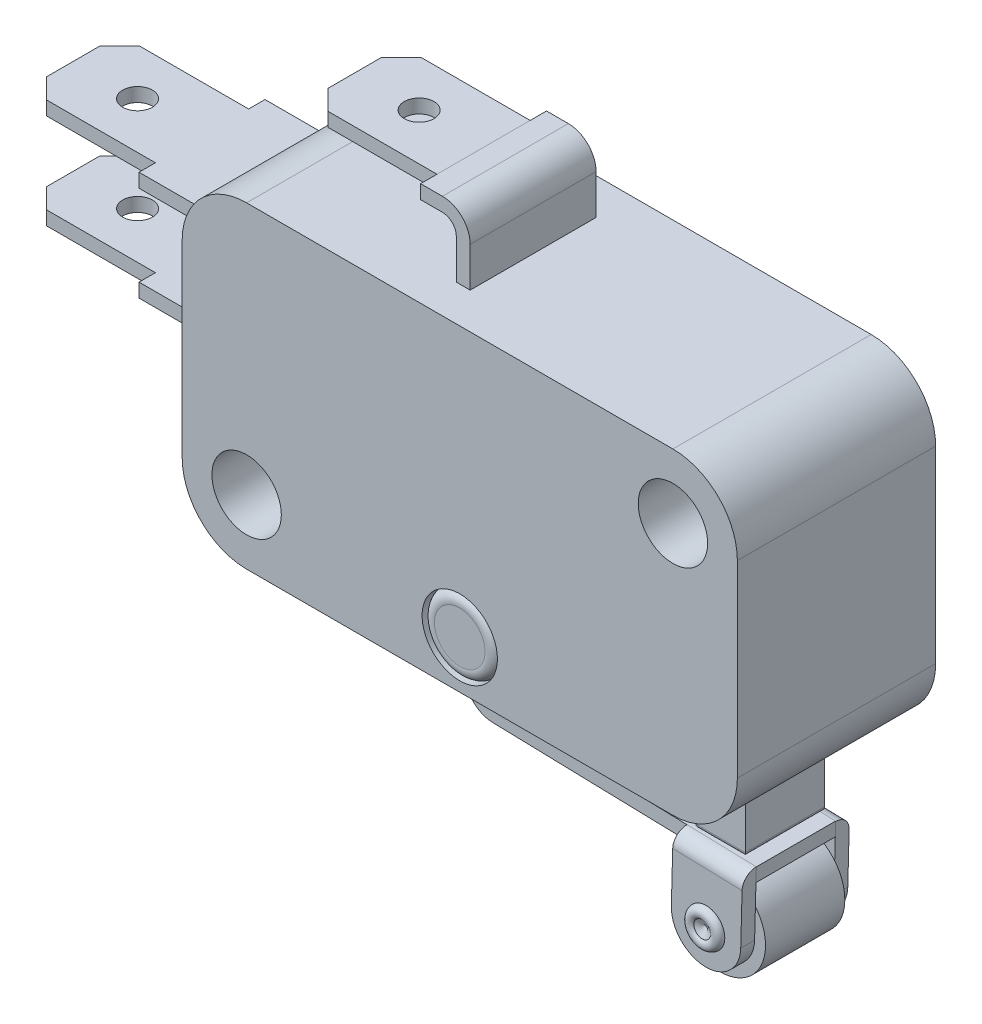
from build123d import *

# Parameters (mm, degrees)
ESQUISSE1_R                = 1.75
ESQUISSE1_R_2              = 1.9
BOSS_EXTRU_1_DEPTH         = 10
ENL_V_MAT_EXTRU_1_DEPTH    = 3
BOSS_EXTRU_6_DEPTH         = 4
CONG_1_R                   = 0.2
BOSS_EXTRU_7_DEPTH         = 4
ESQUISSE11_W               = 0.7
ESQUISSE11_H               = 5
BOSS_EXTRU_8_DEPTH         = 3.5
BOSS_EXTRU_8_2_DEPTH       = 3.5
CONG_2_R                   = 1.75
CONG_3_R                   = 1.75
CONG_4_R                   = 0.7
CONG_5_R                   = 0.7
ESQUISSE12_R               = 0.75
ENL_V_MAT_EXTRU_2_DEPTH    = 23.696495837
ESQUISSE13_R               = 2.3
BOSS_EXTRU_9_DEPTH         = 4
ESQUISSE3_R                = 1.9
BOSS_EXTRU_2_DEPTH         = 3
ESQUISSE6_R                = 0.75
BOSS_EXTRU_3_DEPTH         = 0.7
R_P_TITION_LIN_AIRE1_COUNT = 2
R_P_TITION_LIN_AIRE1_PITCH = 4.8
BOSS_EXTRU_4_DEPTH         = 6.35
ESQUISSE8_R                = 0.75
BOSS_EXTRU_5_DEPTH         = 0.7


with BuildPart() as part:
    # Esquisse1 → Boss.-Extru.1 (new body)
    with BuildSketch(Plane.XY):
        with BuildLine():
            Line((10.75, -8), (-10.75, -8))
            ThreePointArc((-10.75, -8), (-13.048097039, -7.048097039), (-14, -4.75))
            Line((-14, -4.75), (-14, 4.75))
            ThreePointArc((-14, 4.75), (-13.048097039, 7.048097039), (-10.75, 8))
            Line((-10.75, 8), (10.75, 8))
            ThreePointArc((10.75, 8), (13.048097039, 7.048097039), (14, 4.75))
            Line((14, 4.75), (14, -4.75))
            ThreePointArc((14, -4.75), (13.048097039, -7.048097039), (10.75, -8))
        make_face()
        with Locations((10.75, 4.75)):
            Circle(ESQUISSE1_R, mode=Mode.SUBTRACT)
        with Locations((-10.75, -4.75)):
            Circle(ESQUISSE1_R, mode=Mode.SUBTRACT)
        with Locations((0, -5.6)):
            Circle(ESQUISSE1_R_2, mode=Mode.SUBTRACT)
    extrude(amount=-BOSS_EXTRU_1_DEPTH)

    # Esquisse2 → Enlèv. mat.-Extru.1 (cut)
    with BuildSketch(Plane.XY):
        with BuildLine():
            Line((-10.75, 8), (8.5, 8))
            Line((8.5, 8), (8.5, 4.75))
            ThreePointArc((8.5, 4.75), (9.159009742, 3.159009742), (10.75, 2.5))
            Line((10.75, 2.5), (14, 2.5))
            Line((14, 2.5), (14, -4.75))
            ThreePointArc((14, -4.75), (13.048097039, -7.048097039), (10.75, -8))
            Line((10.75, -8), (-8.5, -8))
            Line((-8.5, -8), (-8.5, -4.75))
            ThreePointArc((-8.5, -4.75), (-9.159009742, -3.159009742), (-10.75, -2.5))
            Line((-10.75, -2.5), (-14, -2.5))
            Line((-14, -2.5), (-14, 4.75))
            ThreePointArc((-14, 4.75), (-13.048097039, 7.048097039), (-10.75, 8))
        make_face()
    extrude(amount=-ENL_V_MAT_EXTRU_1_DEPTH, mode=Mode.SUBTRACT)



with BuildPart() as body_2:
    # Esquisse9 → Boss.-Extru.6 (new body)
    with BuildSketch(Plane.XY.offset(-3)):
        Polygon((8.9, -8), (8.9, -11), (11.4, -11), (11.4, -8), (11.4, -7), (8.9, -7), align=None)
    extrude(amount=-BOSS_EXTRU_6_DEPTH)

    # Congé1
    cong_1_edges = [body_2.edges().sort_by_distance(p)[0] for p in [
        (10.15, -11, -7),
        (11.4, -11, -5),
        (8.9, -11, -5),
        (10.15, -11, -3),
    ]]
    fillet(cong_1_edges, radius=CONG_1_R)


with BuildPart() as part_1:
    add(part.part)

    add(body_2.part)  # Boss.-Extru.7 merges body 2
    # Esquisse10 → Boss.-Extru.7 (add)
    with BuildSketch(Plane.XY.offset(-3)):
        with BuildLine():
            Line((-1.899320944, -5.549206791), (-2.020293411, -10.072755239))
            ThreePointArc((-2.020293411, -10.072755239), (-1.828573726, -10.573034078), (-1.339256877, -10.791218348))
            Line((-1.339256877, -10.791218348), (11.955989734, -11.146770808))
            Line((11.955989734, -11.146770808), (11.937276447, -11.846520629))
            Line((11.937276447, -11.846520629), (-1.357970164, -11.490968169))
            ThreePointArc((-1.357970164, -11.490968169), (-2.336603862, -11.054599629), (-2.720043233, -10.054041951))
            Line((-2.720043233, -10.054041951), (-2.599070766, -5.530493504))
            Line((-2.599070766, -5.530493504), (-1.899320944, -5.549206791))
        make_face()
    extrude(amount=-BOSS_EXTRU_7_DEPTH)


with BuildPart() as body_2_2:
    # Esquisse11 → Boss.-Extru.8 (new body)
    with BuildSketch(Plane(origin=(12.245328283, -0.327474678, 0), x_dir=(0, 0, -1), z_dir=(0.9996426023327817, -0.026733267689230993, 0))):
        with Locations((2.65, -13.323164304)):
            Rectangle(ESQUISSE11_W, ESQUISSE11_H)
    extrude(amount=-BOSS_EXTRU_8_DEPTH)

    # Congé2
    cong_2_edges = [body_2_2.edges().sort_by_distance(p)[0] for p in [
        (8.323574287, -16.051417383, -2.65),
        (11.822323396, -16.14498382, -2.65),
    ]]
    fillet(cong_2_edges, radius=CONG_2_R - 0.0001)  # a hair under: the kernel refuses the full size

    # Congé4
    cong_4_edges = [body_2_2.edges().sort_by_distance(p)[0] for p in [
        (10.20661518, -11.099987589, -2.3),
    ]]
    fillet(cong_4_edges, radius=CONG_4_R - 0.0001)  # a hair under: the kernel refuses the full size


with BuildPart() as body_3:
    # Esquisse11 → Boss.-Extru.8 2 (new body)
    with BuildSketch(Plane(origin=(12.245328283, -0.327474678, 0), x_dir=(0, 0, -1), z_dir=(0.9996426023327817, -0.026733267689230993, 0))):
        with Locations((7.35, -13.343925022)):
            Rectangle(ESQUISSE11_W, ESQUISSE11_H)
    extrude(amount=-BOSS_EXTRU_8_2_DEPTH)

    # Congé3
    cong_3_edges = [body_3.edges().sort_by_distance(p)[0] for p in [
        (11.821768394, -16.165737117, -7.35),
        (8.323019286, -16.07217068, -7.35),
    ]]
    fillet(cong_3_edges, radius=CONG_3_R - 0.0001)  # a hair under: the kernel refuses the full size

    # Congé5
    cong_5_edges = [body_3.edges().sort_by_distance(p)[0] for p in [
        (10.206060178, -11.120740887, -7.7),
    ]]
    fillet(cong_5_edges, radius=CONG_5_R - 0.0001)  # a hair under: the kernel refuses the full size


with BuildPart() as enl_v_mat_extru_2_tool:
    # Esquisse12 → Enlèv. mat.-Extru.2 (new, through all)
    with BuildSketch(Plane.XY.offset(-2.3)):
        with Locations((10.11973206, -14.348826047)):
            Circle(ESQUISSE12_R)
    extrude(amount=-ENL_V_MAT_EXTRU_2_DEPTH)


with BuildPart() as body_2_2_1:
    add(body_2_2.part)

    # Enlèv. mat.-Extru.2: cut by enl_v_mat_extru_2_tool
    add(enl_v_mat_extru_2_tool.part, mode=Mode.SUBTRACT)


with BuildPart() as body_3_1:
    add(body_3.part)

    # Enlèv. mat.-Extru.2: cut by enl_v_mat_extru_2_tool
    add(enl_v_mat_extru_2_tool.part, mode=Mode.SUBTRACT)


with BuildPart() as body_4:
    # Esquisse13 → Boss.-Extru.9 (new body)
    with BuildSketch(Plane.XY.offset(-7)):
        with Locations((10.11973206, -14.348826047)):
            Circle(ESQUISSE13_R)
    extrude(amount=BOSS_EXTRU_9_DEPTH)


with BuildPart() as body_5:
    # Esquisse14 → Révolution3 (revolve)
    with BuildSketch(Plane(origin=(10.495953729, -0.280691459, 0), x_dir=(0, 0, -1), z_dir=(0.9996426023327817, -0.026733267689230993, 0)), mode=Mode.PRIVATE) as r_volution3_sk:
        with BuildLine():
            Line((2.3, -13.323164304), (7.7, -13.323164304))
            Line((7.7, -13.323164304), (7.7, -13.123945463))
            ThreePointArc((7.7, -13.123945463), (7.984261411, -13.319118763), (7.904232859, -13.654517925))
            Line((7.904232859, -13.654517925), (7.7, -14.093925022))
            Line((7.7, -14.093925022), (2.3, -14.073164304))
            Line((2.3, -14.073164304), (2.109386747, -13.654517925))
            ThreePointArc((2.109386747, -13.654517925), (2.018113254, -13.322200994), (2.3, -13.123945463))
            Line((2.3, -13.123945463), (2.3, -13.323164304))
        make_face()
    revolve(r_volution3_sk.sketch.rotate(Axis((10.11973206, -14.348826047, -2.3), (-0.00010277735549151781, -0.003843174889761963, -0.9999926096944827)), 178.468125403), axis=Axis((10.11973206, -14.348826047, -2.3), (-0.00010277735549151781, -0.003843174889761963, -0.9999926096944827)))


with BuildPart() as body_6:
    # Esquisse3 → Boss.-Extru.2 (new body)
    with BuildSketch(Plane.XY.offset(-3)):
        with BuildLine():
            Line((-14, 4.75), (-14, -2.5))
            Line((-14, -2.5), (-10.75, -2.5))
            ThreePointArc((-10.75, -2.5), (-9.159009742, -3.159009742), (-8.5, -4.75))
            Line((-8.5, -4.75), (-8.5, -8))
            Line((-8.5, -8), (10.75, -8))
            ThreePointArc((10.75, -8), (13.048097039, -7.048097039), (14, -4.75))
            Line((14, -4.75), (14, 2.5))
            Line((14, 2.5), (10.75, 2.5))
            ThreePointArc((10.75, 2.5), (9.159009742, 3.159009742), (8.5, 4.75))
            Line((8.5, 4.75), (8.5, 8))
            Line((8.5, 8), (-10.75, 8))
            ThreePointArc((-10.75, 8), (-13.048097039, 7.048097039), (-14, 4.75))
        make_face()
        with Locations((0, -5.6)):
            Circle(ESQUISSE3_R, mode=Mode.SUBTRACT)
    extrude(amount=BOSS_EXTRU_2_DEPTH)


with BuildPart() as body_7:
    # Esquisse5 → Révolution1 (revolve)
    with BuildSketch(Plane(origin=(0, 0, 0), x_dir=(0, 0, -1), z_dir=(1, 0, 0)), mode=Mode.PRIVATE) as r_volution1_sk:
        with BuildLine():
            Line((0.5, -3.713984525), (9.5, -3.713984525))
            ThreePointArc((9.5, -3.713984525), (10.018007737, -4.231992263), (9.5, -4.75))
            Line((9.5, -4.75), (9.5, -5.6))
            Line((9.5, -5.6), (0, -5.6))
            Line((0, -5.6), (0, -4.32357469))
            ThreePointArc((0, -4.32357469), (0.105791879, -3.900496761), (0.5, -3.713984525))
        make_face()
    revolve(r_volution1_sk.sketch.rotate(Axis((0, -5.6, -5.056443534), (0, 0, -1)), 90), axis=Axis((0, -5.6, -5.056443534), (0, 0, -1)))


with BuildPart() as body_8:
    # Esquisse6 → Boss.-Extru.3 (new body)
    with BuildSketch(Plane(origin=(0, 0, 0), x_dir=(1, 0, 0), z_dir=(0, 1, 0))):
        Polygon((-14, 8.175), (-18, 8.175), (-18, 7.35), (-23.5, 7.35), (-24.5, 6.35), (-24.5, 3.65), (-23.5, 2.65), (-18, 2.65), (-18, 1.825), (-14, 1.825), align=None)
        with Locations(Location((-21.25, 5, 0), (0, 0, 270))):
            Circle(ESQUISSE6_R, mode=Mode.SUBTRACT)
    boss_extru_3 = extrude(amount=-BOSS_EXTRU_3_DEPTH)


with BuildPart() as part_2:
    add(part_1.part)

    add(body_6.part)  # Répétition linéaire1 merges body 6
    # Répétition linéaire1: Boss.-Extru.3 ×2
    with Locations(*[(0, i * R_P_TITION_LIN_AIRE1_PITCH, 0) for i in range(1, R_P_TITION_LIN_AIRE1_COUNT)]):
        add(boss_extru_3)


with BuildPart() as body_8_2:
    # Esquisse7 → Boss.-Extru.4 (new body)
    with BuildSketch(Plane.XY.offset(-1.825)):
        with BuildLine():
            Line((-2, 8), (-2, 10))
            ThreePointArc((-2, 10), (-2.205025253, 10.494974747), (-2.7, 10.7))
            Line((-2.7, 10.7), (-3.8, 10.7))
            Line((-3.8, 10.7), (-3.8, 11.4))
            Line((-3.8, 11.4), (-2.7, 11.4))
            ThreePointArc((-2.7, 11.4), (-1.710050506, 10.989949494), (-1.3, 10))
            Line((-1.3, 10), (-1.3, 8))
            Line((-1.3, 8), (-2, 8))
        make_face()
    extrude(amount=-BOSS_EXTRU_4_DEPTH)


with BuildPart() as body_9:
    # Esquisse8 → Boss.-Extru.5 (new body)
    with BuildSketch(Plane(origin=(0, 11.4, 0), x_dir=(1, 0, 0), z_dir=(0, 1, 0))):
        Polygon((-3.8, 7.35), (-9.3, 7.35), (-10.3, 6.35), (-10.3, 3.65), (-9.3, 2.65), (-3.8, 2.65), align=None)
        with Locations(Location((-7.05, 5, 0), (0, 0, 270))):
            Circle(ESQUISSE8_R, mode=Mode.SUBTRACT)
    extrude(amount=-BOSS_EXTRU_5_DEPTH)


solid = Compound([body_2_2_1.part, body_3_1.part, body_4.part, body_5.part, body_7.part, body_8.part, part_2.part, body_8_2.part, body_9.part])
